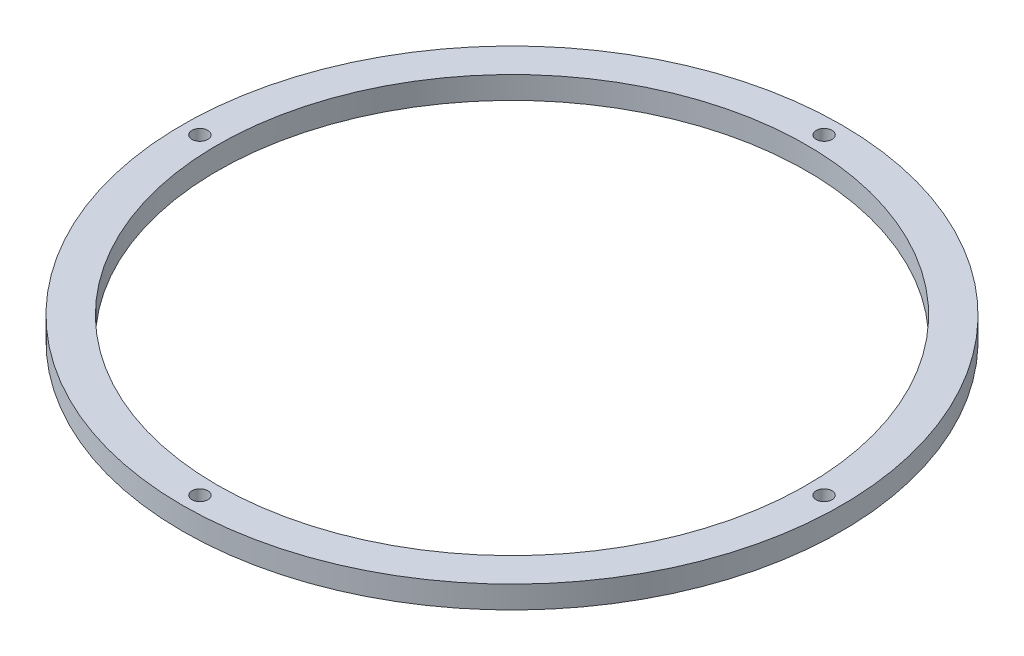
from build123d import *

# Parameters (mm, degrees)
SKETCH1_R           = 125
SKETCH1_R_2         = 111.75
BOSS_EXTRUDE1_DEPTH = 8.5
SKETCH2_R           = 3
CUT_EXTRUDE1_DEPTH  = 177.980931176


with BuildPart() as part:
    # Sketch1 → Boss-Extrude1 (new body)
    with BuildSketch(Plane(origin=(0, 0, 0), x_dir=(1, 0, 0), z_dir=(0, 1, 0))):
        Circle(SKETCH1_R)
        Circle(SKETCH1_R_2, mode=Mode.SUBTRACT)
    extrude(amount=BOSS_EXTRUDE1_DEPTH)

    # Sketch2 → Cut-Extrude1 (cut, through all)
    with BuildSketch(Plane(origin=(0, 8.5, 0), x_dir=(1, 0, 0), z_dir=(0, 1, 0))):
        with Locations((0, 118.375)):
            Circle(SKETCH2_R)
        with Locations((118.375, 0)):
            Circle(SKETCH2_R)
        with Locations((0, -118.375)):
            Circle(SKETCH2_R)
        with Locations((-118.375, 0)):
            Circle(SKETCH2_R)
    extrude(amount=-CUT_EXTRUDE1_DEPTH, mode=Mode.SUBTRACT)


solid = part.part
